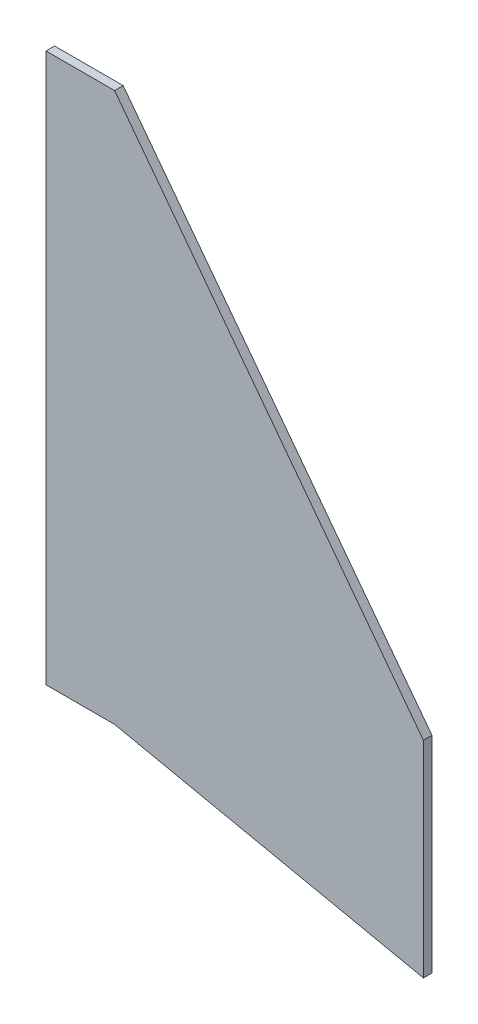
from build123d import *

# Parameters (mm, degrees)
BOSS_EXTRUDE1_DEPTH = 1.5875


with BuildPart() as part:
    # Sketch1 → Boss-Extrude1 (new, symmetric)
    with BuildSketch(Plane.XY):
        Polygon((114.3, -151.131690755), (0, 0), (-25.4, 0), (-25.4, -203.2), (0, -203.2), (114.3, -227.331690755), align=None)
    extrude(amount=BOSS_EXTRUDE1_DEPTH, both=True)


solid = part.part
